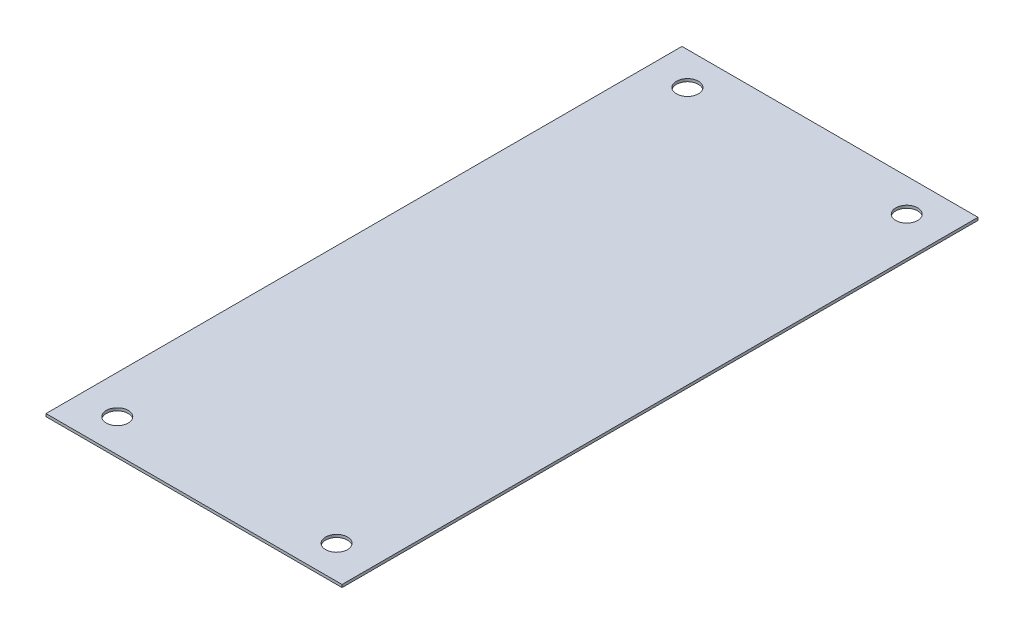
from build123d import *

# Parameters (mm, degrees)
SKETCH1_W                  = 342.9
SKETCH1_H                  = 736.6
BOSS_EXTRUDE1_DEPTH        = 3.175
F_1_1_DIAMETER_HOLE1_D     = 25.4
F_1_1_DIAMETER_HOLE1_DEPTH = 20.574
F_1_1_DIAMETER_HOLE1_TIP   = 7.630929862


with BuildPart() as part:
    # Sketch1 → Boss-Extrude1 (new body)
    with BuildSketch(Plane(origin=(0, 0, 0), x_dir=(1, 0, 0), z_dir=(0, 1, 0))):
        with Locations((171.45, 368.3)):
            Rectangle(SKETCH1_W, SKETCH1_H)
    extrude(amount=BOSS_EXTRUDE1_DEPTH)

    # 1 (1) Diameter Hole1
    with Locations(Plane(origin=(0, 3.175, 0), x_dir=(-1, 0, 0), z_dir=(0, 1, 0))):
        with Locations((-44.45, -38.1), (-44.45, -698.5), (-298.45, -698.5), (-298.45, -38.1)):
            Hole(F_1_1_DIAMETER_HOLE1_D / 2, depth=F_1_1_DIAMETER_HOLE1_DEPTH)
            with Locations((0, 0, -(F_1_1_DIAMETER_HOLE1_DEPTH + F_1_1_DIAMETER_HOLE1_TIP / 2))):  # 118° drill point
                Cone(0, F_1_1_DIAMETER_HOLE1_D / 2, F_1_1_DIAMETER_HOLE1_TIP, mode=Mode.SUBTRACT)


solid = part.part
